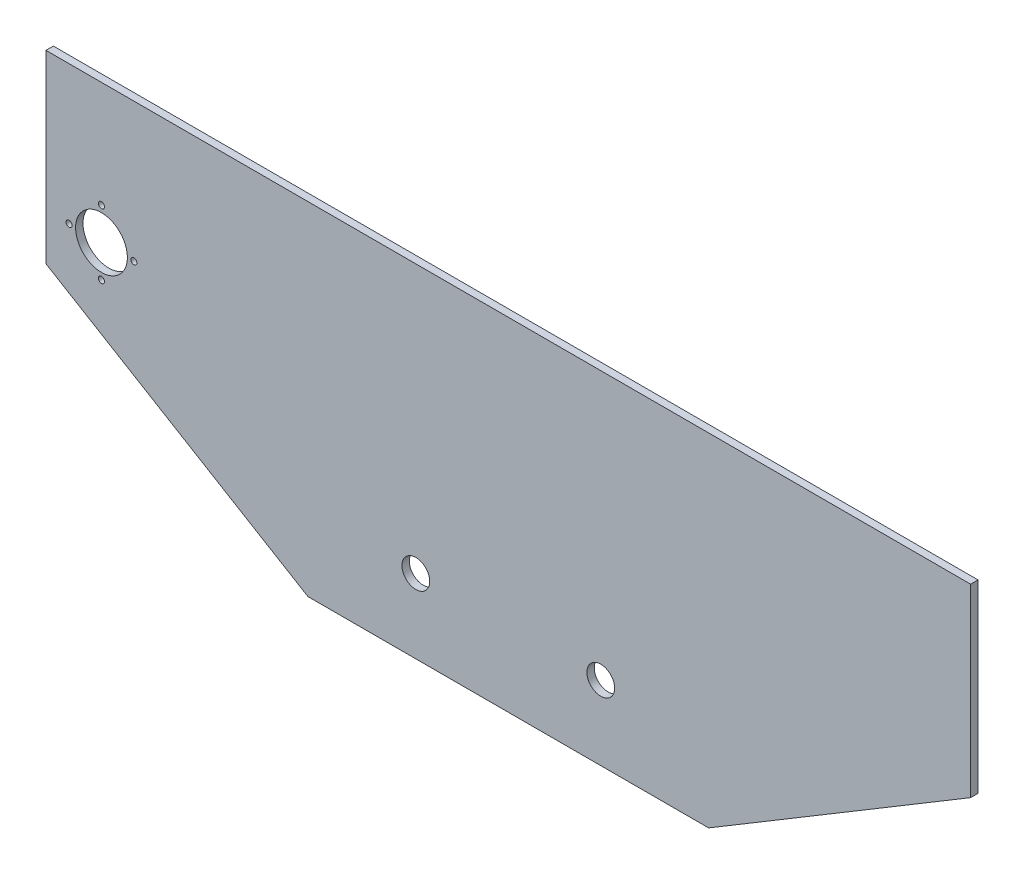
from build123d import *

# Parameters (mm, degrees)
SKETCH_2_W             = 500
SKETCH_2_H             = 150
SM_BASE_FLANGE_1_DEPTH = 4
SKETCH_7_R             = 7.5
CUT_EXTRUDE_1_DEPTH    = 10
CUT_EXTRUDE_2_DEPTH    = 10
SKETCH_9_W             = 500
SKETCH_9_H             = 70
EXTRUDE_1_DEPTH        = 4
SKETCH_11_W            = 294.318295345
SKETCH_11_H            = 76.206928483
CUT_EXTRUDE_3_DEPTH    = 10
SKETCH_12_R            = 14
CUT_EXTRUDE_4_DEPTH    = 10
SKETCH_13_R            = 1.65
CUT_EXTRUDE_5_DEPTH    = 10


# Sheet-metal steps are written as plain solids
with BuildPart() as part:
    # Sketch 2 → 基体-法兰1 (new body)
    with BuildSketch(Plane.XY):
        Rectangle(SKETCH_2_W, SKETCH_2_H)
    extrude(amount=-SM_BASE_FLANGE_1_DEPTH)

    # 草图7 → 切除-拉伸1 (cut)
    with BuildSketch(Plane.XY):
        with Locations((-50, 0)):
            Circle(SKETCH_7_R)
        with Locations((50, 0)):
            Circle(SKETCH_7_R)
    extrude(amount=-CUT_EXTRUDE_1_DEPTH, mode=Mode.SUBTRACT)

    # 草图8 → 切除-拉伸2 (cut)
    with BuildSketch(Plane.XY):
        Polygon((250, 45), (50, -75), (250, -75), align=None)
        Polygon((-250, -75), (-250, 45), (-50, -75), align=None)
    extrude(amount=-CUT_EXTRUDE_2_DEPTH, mode=Mode.SUBTRACT)

    # 草图9 → 凸台-拉伸1 (add)
    with BuildSketch(Plane(origin=(0, 0, -4), x_dir=(-1, 0, 0), z_dir=(0, 0, -1))):
        with Locations((0, 110)):
            Rectangle(SKETCH_9_W, SKETCH_9_H)
    extrude(amount=-EXTRUDE_1_DEPTH)

    # 草图11 → 切除-拉伸3 (cut)
    with BuildSketch(Plane(origin=(0, 0, -4), x_dir=(-1, 0, 0), z_dir=(0, 0, -1))):
        with Locations((38.825814339, -78.103464242)):
            Rectangle(SKETCH_11_W, SKETCH_11_H)
    extrude(amount=-CUT_EXTRUDE_3_DEPTH, mode=Mode.SUBTRACT)

    # 草图12 → 切除-拉伸4 (cut)
    with BuildSketch(Plane(origin=(0, 0, -4), x_dir=(-1, 0, 0), z_dir=(0, 0, -1))):
        with Locations((220, 70)):
            Circle(SKETCH_12_R)
    extrude(amount=-CUT_EXTRUDE_4_DEPTH, mode=Mode.SUBTRACT)

    # 草图13 → 切除-拉伸5 (cut)
    with BuildSketch(Plane(origin=(0, 0, -4), x_dir=(-1, 0, 0), z_dir=(0, 0, -1))):
        with Locations((220, 87.5)):
            Circle(SKETCH_13_R)
        with Locations((237.5, 70)):
            Circle(SKETCH_13_R)
        with Locations((220, 52.5)):
            Circle(SKETCH_13_R)
        with Locations((202.5, 70)):
            Circle(SKETCH_13_R)
    extrude(amount=-CUT_EXTRUDE_5_DEPTH, mode=Mode.SUBTRACT)


solid = part.part
